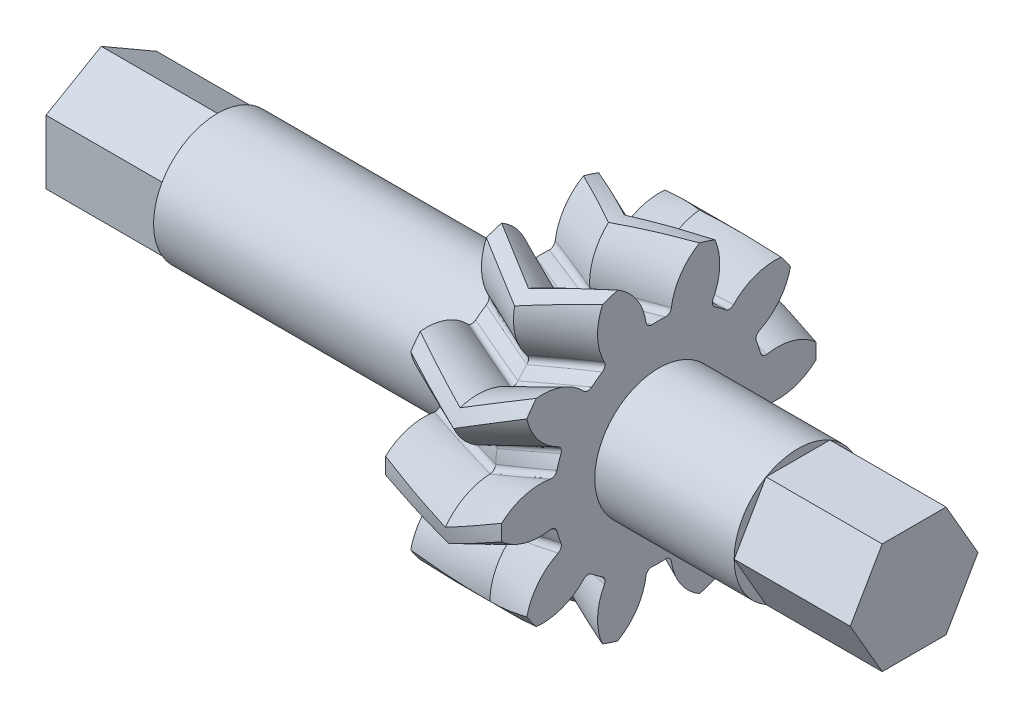
from build123d import *

# Parameters (mm, degrees)
BASPROSKE_W             = 5
BASPROSKE_H             = 13.547005384
TOOTHCUTRH_PITCH        = 147.429298514
TOOTHCUTRH_HEIGHT       = 5
TOOTHCUTRH_RADIUS       = 13.547005384
TOOTHCUTRH_START_ANGLE  = -90
TEETHCUTSRH_COUNT       = 10
TEETHCUTSRH_ANGLE       = 324
BORSKE_R                = 5.5
BORE_DEPTH              = 62.5000025
BOSS_EXTRU_1_DEPTH      = 38
BOSS_EXTRU_1_DEPTH_BACK = 32
ESQUISSE1_R             = 5.5
ENL_V_MAT_EXTRU_1_DEPTH = 10
ENL_V_MAT_EXTRU_2_DEPTH = 10


with BuildPart() as part:
    # BasProSke → Base-Revolve (revolve)
    with BuildSketch(Plane(origin=(0, 0, 0), x_dir=(1, 0, 0), z_dir=(0, 1, 0)), mode=Mode.PRIVATE) as base_revolve_sk:
        with Locations((2.5, 6.773502692)):
            Rectangle(BASPROSKE_W, BASPROSKE_H)
    revolve(base_revolve_sk.sketch.rotate(Axis((-10, 0, 0), (1, 0, 0)), 180), axis=Axis((-10, 0, 0), (1, 0, 0)))

    # ToothCutRH: sweep along a helix
    with BuildLine() as toothcutrh_path:
        add(Helix(TOOTHCUTRH_PITCH, TOOTHCUTRH_HEIGHT, TOOTHCUTRH_RADIUS, center=(0, 0, 0), direction=(1, 0, 0), mode=Mode.PRIVATE).rotate(Axis((0, 0, 0), (1, 0, 0)), TOOTHCUTRH_START_ANGLE))
    # TooCutSkeRH → ToothCutRH (sweep, cut)
    with BuildSketch(Plane(origin=(0, 0, 0), x_dir=(0, 0, -1), z_dir=(1, 0, 0))):
        with BuildLine():
            ThreePointArc((0.56474538, 9.029361498), (0, 9.047005384), (-0.56474538, 9.029361498))
            ThreePointArc((-0.56474538, 9.029361498), (-0.912719018, 9.141180308), (-1.092137157, 9.459611196))
            ThreePointArc((-1.092137157, 9.459611196), (-2.065450401, 11.792434954), (-4.055435717, 13.351076606))
            ThreePointArc((-4.055435717, 13.351076606), (0, 13.953415545), (4.055435717, 13.351076606))
            ThreePointArc((4.055435717, 13.351076606), (2.065450401, 11.792434954), (1.092137157, 9.459611196))
            ThreePointArc((1.092137157, 9.459611196), (0.912719018, 9.141180308), (0.56474538, 9.029361498))
        make_face()
    toothcutrh = sweep(path=toothcutrh_path.line, is_frenet=True, mode=Mode.SUBTRACT)

    # TeethCutsRH: ToothCutRH ×10 about axis
    teethcutsrh_axis = Axis((-10, 0, 0), (1, 0, 0))
    for i in range(1, TEETHCUTSRH_COUNT):
        add(toothcutrh.rotate(teethcutsrh_axis, i * TEETHCUTSRH_ANGLE / (TEETHCUTSRH_COUNT - 1)), mode=Mode.SUBTRACT)

    # BorSke → Bore (cut, symmetric)
    with BuildSketch(Plane(origin=(0, 0, 0), x_dir=(0, 0, -1), z_dir=(1, 0, 0))):
        with Locations(Location((0, 0, 0), (0, 0, 180))):
            Circle(BORSKE_R)
    extrude(amount=BORE_DEPTH, both=True, mode=Mode.SUBTRACT)

    # Symétrie1: part across face


with BuildPart() as part_1:
    add(part.part)
    add(part.part.mirror(Plane(origin=(5, 0, 0), x_dir=(0, 0, 1), z_dir=(1, 0, 0))))


with BuildPart() as body_2:
    # Esquisse1 → Boss.-Extru.1 (new, two sides: drawn at the far end of the back side and taken through both)
    with BuildSketch(Plane.ZY.offset(-BOSS_EXTRU_1_DEPTH_BACK)):
        Circle(ESQUISSE1_R)
    extrude(amount=BOSS_EXTRU_1_DEPTH + BOSS_EXTRU_1_DEPTH_BACK)

    # Esquisse2 → Enlèv. mat.-Extru.1 (cut)
    with BuildSketch(Plane.YZ.offset(32)):
        with BuildLine():
            ThreePointArc((4.763139721, 2.75), (2.75, 4.763139721), (0, 5.5))
            Line((0, 5.5), (4.763139721, 2.75))
        make_face()
        with BuildLine():
            ThreePointArc((5.5, 0), (5.312592045, 1.423504748), (4.763139721, 2.75))
            Line((4.763139721, 2.75), (4.763139721, -2.75))
            ThreePointArc((4.763139721, -2.75), (5.312592045, -1.423504748), (5.5, 0))
        make_face()
        with BuildLine():
            Line((-4.763139721, 2.75), (0, 5.5))
            ThreePointArc((0, 5.5), (-2.75, 4.763139721), (-4.763139721, 2.75))
        make_face()
        with BuildLine():
            Line((-4.763139721, -2.75), (-4.763139721, 2.75))
            ThreePointArc((-4.763139721, 2.75), (-5.5, 0), (-4.763139721, -2.75))
        make_face()
        with BuildLine():
            Line((0, -5.5), (-4.763139721, -2.75))
            ThreePointArc((-4.763139721, -2.75), (-2.75, -4.763139721), (0, -5.5))
        make_face()
        with BuildLine():
            ThreePointArc((0, -5.5), (2.75, -4.763139721), (4.763139721, -2.75))
            Line((4.763139721, -2.75), (0, -5.5))
        make_face()
    extrude(amount=-ENL_V_MAT_EXTRU_1_DEPTH, mode=Mode.SUBTRACT)

    # Esquisse3 → Enlèv. mat.-Extru.2 (cut)
    with BuildSketch(Plane.ZY.offset(38)):
        with BuildLine():
            ThreePointArc((0, -5.5), (2.75, -4.763139721), (4.763139721, -2.75))
            Line((4.763139721, -2.75), (0, -5.5))
        make_face()
        with BuildLine():
            ThreePointArc((5.5, 0), (5.312592045, 1.423504748), (4.763139721, 2.75))
            Line((4.763139721, 2.75), (4.763139721, -2.75))
            ThreePointArc((4.763139721, -2.75), (5.312592045, -1.423504748), (5.5, 0))
        make_face()
        with BuildLine():
            ThreePointArc((4.763139721, 2.75), (2.75, 4.763139721), (0, 5.5))
            Line((0, 5.5), (4.763139721, 2.75))
        make_face()
        with BuildLine():
            Line((-4.763139721, 2.75), (0, 5.5))
            ThreePointArc((0, 5.5), (-2.75, 4.763139721), (-4.763139721, 2.75))
        make_face()
        with BuildLine():
            Line((-4.763139721, -2.75), (-4.763139721, 2.75))
            ThreePointArc((-4.763139721, 2.75), (-5.5, 0), (-4.763139721, -2.75))
        make_face()
        with BuildLine():
            Line((0, -5.5), (-4.763139721, -2.75))
            ThreePointArc((-4.763139721, -2.75), (-2.75, -4.763139721), (0, -5.5))
        make_face()
    extrude(amount=-ENL_V_MAT_EXTRU_2_DEPTH, mode=Mode.SUBTRACT)


solid = Compound([part_1.part, body_2.part])
